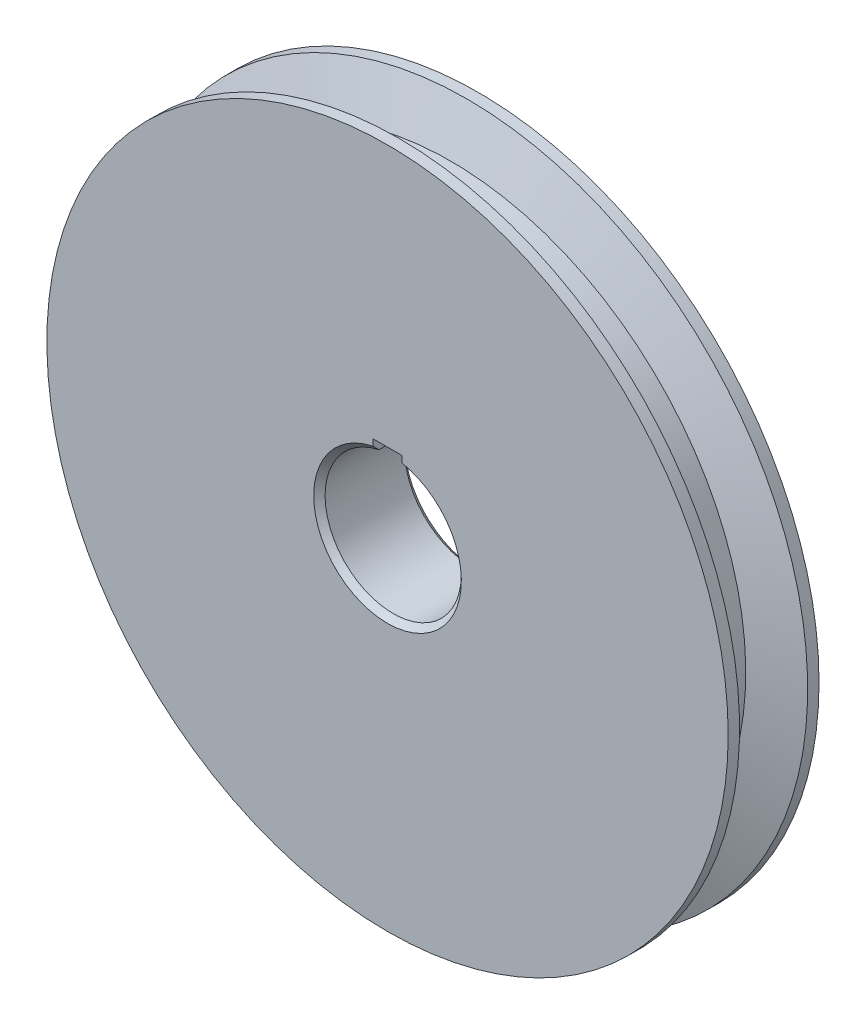
from build123d import *

# Parameters (mm, degrees)
SKETCH1_R          = 47.625
SKETCH1_R_2        = 9.525
EXTRUDE1_DEPTH     = 6.35
CHAMFER1_SIZE      = 0.79375
SKETCH3_W          = 4
SKETCH3_H          = 3
CUT_EXTRUDE1_DEPTH = 69.538830235


with BuildPart() as part:
    # Sketch1 → Extrude1 (new, symmetric)
    with BuildSketch(Plane.XY):
        Circle(SKETCH1_R)
        Circle(SKETCH1_R_2, mode=Mode.SUBTRACT)
    extrude(amount=EXTRUDE1_DEPTH, both=True)

    # Chamfer1
    chamfer1_edges = [part.edges().sort_by_distance(p)[0] for p in [
        (-9.525, 0, -6.35),
        (-9.525, 0, 6.35),
    ]]
    chamfer(chamfer1_edges, length=CHAMFER1_SIZE)

    # Sketch2 → Cut-Revolve1 (revolve, cut)
    with BuildSketch(Plane(origin=(0, 0, 0), x_dir=(0, 0, -1), z_dir=(1, 0, 0))):
        Polygon((-4.7625, 47.625), (4.7625, 47.625), (2.451289012, 41.275), (-2.451289012, 41.275), align=None)
    revolve(axis=Axis((0, 0, 6.35), (0, 0, -1)), mode=Mode.SUBTRACT)

    # Sketch3 → Cut-Extrude1 (cut, through all)
    with BuildSketch(Plane.XY.offset(6.35)):
        with Locations((0, 9.525)):
            Rectangle(SKETCH3_W, SKETCH3_H)
    extrude(amount=-CUT_EXTRUDE1_DEPTH, mode=Mode.SUBTRACT)


solid = part.part
